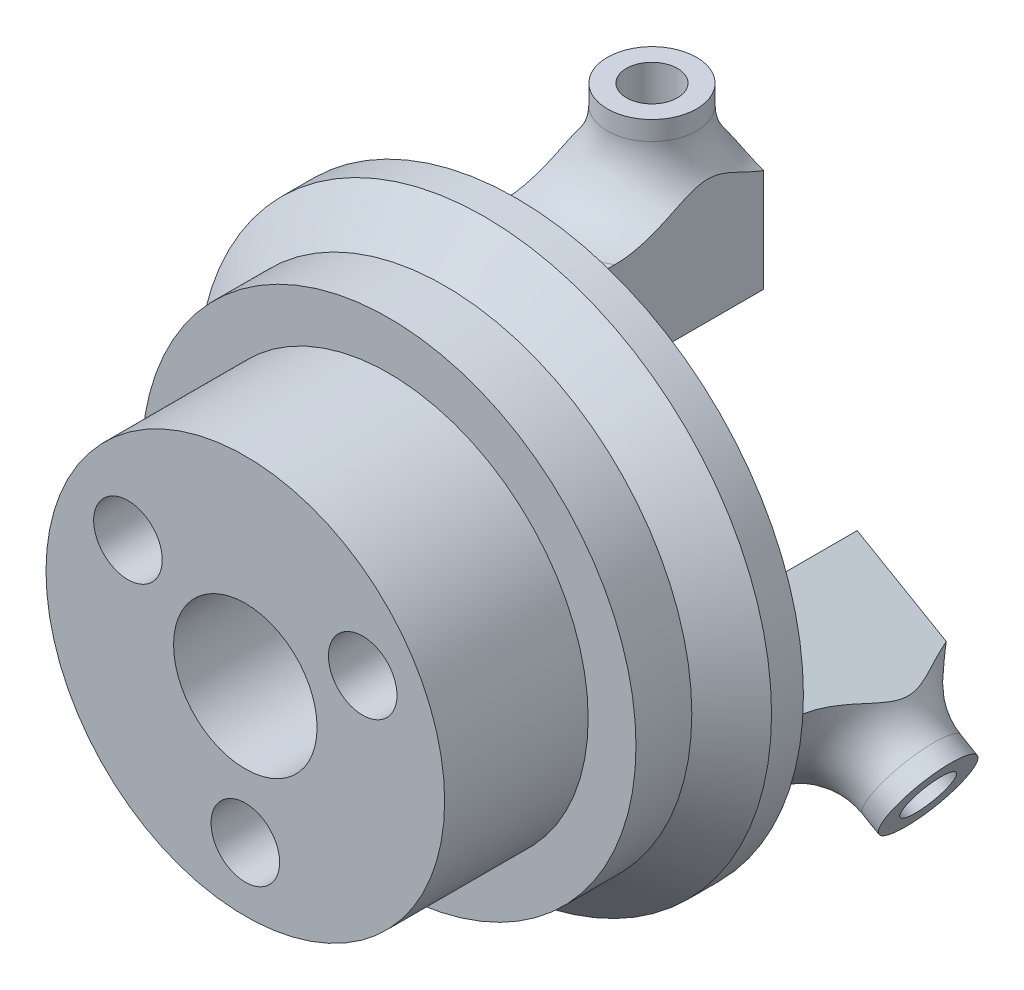
from build123d import *

# Parameters (mm, degrees)
SKETCH1_R                = 18
SKETCH1_R_2              = 4
BOSS_EXTRUDE1_DEPTH      = 2.5
SKETCH5_R                = 7.5
SKETCH5_R_2              = 4
BOSS_EXTRUDE3_DEPTH      = 1
SKETCH8_R                = 12.5
SKETCH8_R_2              = 4.5
BOSS_EXTRUDE5_DEPTH      = 12
SKETCH9_R                = 15.5
SKETCH9_R_2              = 12.5
BOSS_EXTRUDE6_DEPTH      = 3
M4_CLEARANCE_HOLE1_D     = 4.3
CUT_EXTRUDE2_DEPTH       = 2
CIRPATTERN2_COUNT        = 3
SKETCH15_W               = 7
SKETCH15_H               = 6
BOSS_EXTRUDE7_DEPTH      = 12
SKETCH16_R               = 2.8
BOSS_EXTRUDE8_DEPTH      = 5.2
SKETCH17_R               = 1.6
CUT_EXTRUDE3_DEPTH       = 9
CHAMFER1_SIZE            = 3
CUT_EXTRUDE5_DEPTH       = 2.85
FILLET3_R                = 4
FILLET5_R                = 1
CIRPATTERN4_COUNT        = 3
FILLET3_OF_CIRPATTERN4_R = 4
FILLET5_OF_CIRPATTERN4_R = 1
SKETCH19_R               = 4.5
CUT_EXTRUDE6_DEPTH       = 25


with BuildPart() as part:
    # Sketch1 → Boss-Extrude1 (new, symmetric)
    with BuildSketch(Plane.XY):
        Circle(SKETCH1_R)
        Circle(SKETCH1_R_2, mode=Mode.SUBTRACT)
    extrude(amount=BOSS_EXTRUDE1_DEPTH, both=True)

    # Sketch5 → Boss-Extrude3 (add)
    with BuildSketch(Plane.XY.offset(-2.5)):
        Circle(SKETCH5_R)
        Circle(SKETCH5_R_2, mode=Mode.SUBTRACT)
    extrude(amount=BOSS_EXTRUDE3_DEPTH)

    # Sketch8 → Boss-Extrude5 (add)
    with BuildSketch(Plane.XY.offset(2.5)):
        Circle(SKETCH8_R)
        Circle(SKETCH8_R_2, mode=Mode.SUBTRACT)
    extrude(amount=BOSS_EXTRUDE5_DEPTH)

    # Sketch9 → Boss-Extrude6 (add)
    with BuildSketch(Plane.XY.offset(2.5)):
        Circle(SKETCH9_R)
        Circle(SKETCH9_R_2, mode=Mode.SUBTRACT)
    extrude(amount=BOSS_EXTRUDE6_DEPTH)

    # M4 Clearance Hole1 (through all)
    with Locations(Plane.XY.offset(14.5)):
        with Locations((7.361215932, 4.25), (-7.361215932, 4.25), (0, -8.5)):
            Hole(M4_CLEARANCE_HOLE1_D / 2)

    # Sketch14 → Cut-Extrude2 (cut)
    with BuildSketch(Plane(origin=(0, 0, -2.5), x_dir=(-1, 0, 0), z_dir=(0, 0, -1))):
        Polygon((-11.691342951, 4.25), (-9.526279442, 8), (-5.196152423, 8), (-3.031088913, 4.25), (-5.196152423, 0.5), (-9.526279442, 0.5), align=None)
    cut_extrude2 = extrude(amount=-CUT_EXTRUDE2_DEPTH, mode=Mode.SUBTRACT)

    # CirPattern2: Cut-Extrude2 ×3 about axis
    cirpattern2_axis = Axis((0, 0, 0), (0, 0, 1))
    for i in range(1, CIRPATTERN2_COUNT):
        add(cut_extrude2.rotate(cirpattern2_axis, i * 360 / CIRPATTERN2_COUNT), mode=Mode.SUBTRACT)

    # Sketch15 → Boss-Extrude7 (add)
    with BuildSketch(Plane(origin=(0, 0, -2.5), x_dir=(-1, 0, 0), z_dir=(0, 0, -1))):
        with Locations((0, 11.8)):
            Rectangle(SKETCH15_W, SKETCH15_H)
    boss_extrude7 = extrude(amount=BOSS_EXTRUDE7_DEPTH)

    # Sketch16 → Boss-Extrude8 (add)
    with BuildSketch(Plane(origin=(0, 14.8, 0), x_dir=(1, 0, 0), z_dir=(0, 1, 0))):
        with Locations(Location((0, 11, 0), (0, 0, 90))):
            Circle(SKETCH16_R)
    boss_extrude8 = extrude(amount=BOSS_EXTRUDE8_DEPTH)

    # Sketch17 → Cut-Extrude3 (cut)
    with BuildSketch(Plane(origin=(0, 20, 0), x_dir=(1, 0, 0), z_dir=(0, 1, 0))):
        with Locations(Location((0, 11, 0), (0, 0, 270))):
            Circle(SKETCH17_R)
    cut_extrude3 = extrude(amount=-CUT_EXTRUDE3_DEPTH, mode=Mode.SUBTRACT)

    # Chamfer1
    # the kernel refuses this chamfer: 3 mm, written as the material it takes off along each edge
    with BuildSketch(Plane(origin=(0, 0, 2.5), x_dir=(1, 0, 0), z_dir=(0, -1, 0))) as chamfer1_piece_1_section:
        Polygon((18, -CHAMFER1_SIZE), (18 - CHAMFER1_SIZE, 0), (18, 0), align=None)
    chamfer1_piece_1 = revolve(axis=Axis((0, 0, 2.5), (0, 0, 1)), mode=Mode.PRIVATE)
    chamfer1_piece_1 = chamfer1_piece_1 - Plane(origin=(0, 0, 0.764094919), x_dir=(1, 0, 0), z_dir=(0, 0, -1)) * Cylinder(15.5, 72, mode=Mode.PRIVATE)
    add(chamfer1_piece_1, mode=Mode.SUBTRACT)

    # Sketch18 → Cut-Extrude5 (cut)
    with BuildSketch(Plane.XZ.offset(-8.8)):
        Polygon((-2.85, -9.354551733), (0, -7.709103466), (2.85, -9.354551733), (2.85, -12.645448267), (0, -14.290896534), (-2.85, -12.645448267), align=None)
    cut_extrude5 = extrude(amount=-CUT_EXTRUDE5_DEPTH, mode=Mode.SUBTRACT)

    # Fillet3
    # the kernel refuses this fillet: 4 mm, written as the material it adds along each edge
    with BuildSketch(Plane(origin=(0, 14.8, -11), x_dir=(0, 0, -1), z_dir=(1, 0, 0))) as fillet3_piece_1_section:
        with BuildLine():
            CenterArc((2.8 + FILLET3_R, FILLET3_R), FILLET3_R, 180, 90)
            Line((2.8, FILLET3_R), (2.8, 0))
            Line((2.8, 0), (2.8 + FILLET3_R, 0))
        make_face()
    fillet3_piece_1 = revolve(axis=Axis((0, 14.8, -11), (0, 1, 0)), mode=Mode.PRIVATE)
    fillet3_piece_1 = split(fillet3_piece_1, bisect_by=Plane(origin=(3.5, 15.943283653, -7.056716347), z_dir=(-1, 0, 0)), keep=Keep.TOP, mode=Mode.PRIVATE)
    fillet3_piece_1 = split(fillet3_piece_1, bisect_by=Plane(origin=(-3.5, 15.943283653, -7.056716347), z_dir=(1, 0, 0)), keep=Keep.TOP, mode=Mode.PRIVATE)
    fillet3_piece_1 = split(fillet3_piece_1, bisect_by=Plane(origin=(0, 15.943283653, -14.5), z_dir=(0, 0, 1)), keep=Keep.TOP, mode=Mode.PRIVATE)
    add(fillet3_piece_1)

    # Fillet5
    fillet5_edges = [part.edges().sort_by_distance(p)[0] for p in [
        (-3.5, 11.8, -2.5),
        (3.5, 11.8, -2.5),
        (0, 8.8, -2.5),
    ]]
    fillet(fillet5_edges, radius=FILLET5_R)

    # CirPattern4: Boss-Extrude7, Boss-Extrude8, Cut-Extrude3, Cut-Extrude5 ×3 about axis
    cirpattern4_axis = Axis((0, 0, 0), (0, 0, 1))
    add([boss_extrude7.rotate(cirpattern4_axis, i * 360 / CIRPATTERN4_COUNT) for i in range(1, CIRPATTERN4_COUNT)])
    add([boss_extrude8.rotate(cirpattern4_axis, i * 360 / CIRPATTERN4_COUNT) for i in range(1, CIRPATTERN4_COUNT)])
    add([cut_extrude3.rotate(cirpattern4_axis, i * 360 / CIRPATTERN4_COUNT) for i in range(1, CIRPATTERN4_COUNT)], mode=Mode.SUBTRACT)
    add([cut_extrude5.rotate(cirpattern4_axis, i * 360 / CIRPATTERN4_COUNT) for i in range(1, CIRPATTERN4_COUNT)], mode=Mode.SUBTRACT)

    # Fillet3 of CirPattern4
    # the kernel refuses this fillet: 4 mm, written as the material it adds along each edge
    with BuildSketch(Plane(origin=(-12.817175976, -7.4, -11), x_dir=(0, 0, -1), z_dir=(-0.49999999999999983, 0.8660254037844388, 0))) as fillet3_of_cirpattern4_piece_1_section:
        with BuildLine():
            CenterArc((2.8 + FILLET3_OF_CIRPATTERN4_R, FILLET3_OF_CIRPATTERN4_R), FILLET3_OF_CIRPATTERN4_R, 180, 90)
            Line((2.8, FILLET3_OF_CIRPATTERN4_R), (2.8, 0))
            Line((2.8, 0), (2.8 + FILLET3_OF_CIRPATTERN4_R, 0))
        make_face()
    fillet3_of_cirpattern4_piece_1 = revolve(axis=Axis((-12.817175976, -7.4, -11), (-0.8660254037844388, -0.49999999999999983, 0)), mode=Mode.PRIVATE)
    fillet3_of_cirpattern4_piece_1 = split(fillet3_of_cirpattern4_piece_1, bisect_by=Plane(origin=(-15.557288663, -4.940552913, -7.056716347), z_dir=(0.49999999999999983, -0.8660254037844388, 0)), keep=Keep.TOP, mode=Mode.PRIVATE)
    fillet3_of_cirpattern4_piece_1 = split(fillet3_of_cirpattern4_piece_1, bisect_by=Plane(origin=(-12.057288663, -11.00273074, -7.056716347), z_dir=(-0.49999999999999983, 0.8660254037844388, 0)), keep=Keep.TOP, mode=Mode.PRIVATE)
    fillet3_of_cirpattern4_piece_1 = split(fillet3_of_cirpattern4_piece_1, bisect_by=Plane(origin=(-13.807288663, -7.971641826, -14.5), z_dir=(0, 0, 1)), keep=Keep.TOP, mode=Mode.PRIVATE)
    add(fillet3_of_cirpattern4_piece_1)
    with BuildSketch(Plane(origin=(12.817175976, -7.4, -11), x_dir=(0, 0, -1), z_dir=(-0.5000000000000004, -0.8660254037844384, 0))) as fillet3_of_cirpattern4_piece_2_section:
        with BuildLine():
            CenterArc((2.8 + FILLET3_OF_CIRPATTERN4_R, FILLET3_OF_CIRPATTERN4_R), FILLET3_OF_CIRPATTERN4_R, 180, 90)
            Line((2.8, FILLET3_OF_CIRPATTERN4_R), (2.8, 0))
            Line((2.8, 0), (2.8 + FILLET3_OF_CIRPATTERN4_R, 0))
        make_face()
    fillet3_of_cirpattern4_piece_2 = revolve(axis=Axis((12.817175976, -7.4, -11), (0.8660254037844384, -0.5000000000000004, 0)), mode=Mode.PRIVATE)
    fillet3_of_cirpattern4_piece_2 = split(fillet3_of_cirpattern4_piece_2, bisect_by=Plane(origin=(12.057288663, -11.00273074, -7.056716347), z_dir=(0.5000000000000004, 0.8660254037844384, 0)), keep=Keep.TOP, mode=Mode.PRIVATE)
    fillet3_of_cirpattern4_piece_2 = split(fillet3_of_cirpattern4_piece_2, bisect_by=Plane(origin=(15.557288663, -4.940552913, -7.056716347), z_dir=(-0.5000000000000004, -0.8660254037844384, 0)), keep=Keep.TOP, mode=Mode.PRIVATE)
    fillet3_of_cirpattern4_piece_2 = split(fillet3_of_cirpattern4_piece_2, bisect_by=Plane(origin=(13.807288663, -7.971641826, -14.5), z_dir=(0, 0, 1)), keep=Keep.TOP, mode=Mode.PRIVATE)
    add(fillet3_of_cirpattern4_piece_2)

    # Fillet5 of CirPattern4
    fillet5_of_cirpattern4_edges = [part.edges().sort_by_distance(p)[0] for p in [
        (-8.469099765, -8.931088913, -2.5),
        (-11.969099765, -2.868911087, -2.5),
        (-7.621023553, -4.4, -2.5),
        (11.969099765, -2.868911087, -2.5),
        (8.469099765, -8.931088913, -2.5),
        (7.621023553, -4.4, -2.5),
    ]]
    fillet(fillet5_of_cirpattern4_edges, radius=FILLET5_OF_CIRPATTERN4_R)

    # Sketch19 → Cut-Extrude6 (cut)
    with BuildSketch(Plane(origin=(0, 0, -2.5), x_dir=(-1, 0, 0), z_dir=(0, 0, -1))):
        Circle(SKETCH19_R)
    extrude(amount=-CUT_EXTRUDE6_DEPTH, mode=Mode.SUBTRACT)


solid = part.part
